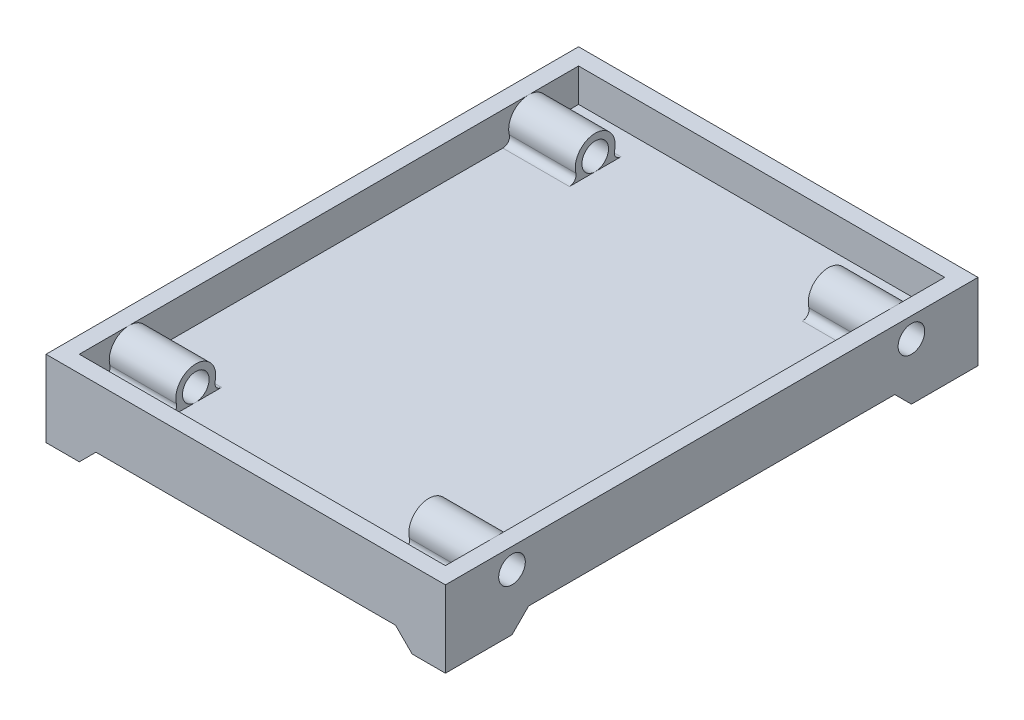
from build123d import *

# Parameters (mm, degrees)
SKETCH1_W           = 76.2
SKETCH1_H           = 101.6
BOSS_EXTRUDE1_DEPTH = 5.08
SKETCH4_W           = 76.2
SKETCH4_H           = 101.6
SKETCH4_W_2         = 69.85
SKETCH4_H_2         = 95.25
BOSS_EXTRUDE3_DEPTH = 6.35
SKETCH5_R           = 3.81
SKETCH5_R_2         = 2.54
BOSS_EXTRUDE4_DEPTH = 73.025
SKETCH6_R           = 2.54
CUT_EXTRUDE2_DEPTH  = 128.513312638
SKETCH7_W           = 44.45
SKETCH7_H           = 95.25
CUT_EXTRUDE3_DEPTH  = 128.158650905
FILLET1_R           = 1.27
SKETCH8_W           = 6.35
SKETCH8_H           = 12.7
BOSS_EXTRUDE5_DEPTH = 3.175
CHAMFER1_SIZE       = 3.175


with BuildPart() as part:
    # Sketch1 → Boss-Extrude1 (new body)
    with BuildSketch(Plane(origin=(0, 0, 0), x_dir=(1, 0, 0), z_dir=(0, 1, 0))):
        with Locations((38.1, 50.8)):
            Rectangle(SKETCH1_W, SKETCH1_H)
    extrude(amount=BOSS_EXTRUDE1_DEPTH)

    # Sketch4 → Boss-Extrude3 (add)
    with BuildSketch(Plane(origin=(0, 5.08, 0), x_dir=(1, 0, 0), z_dir=(0, 1, 0))):
        with Locations((38.1, 50.8)):
            Rectangle(SKETCH4_W, SKETCH4_H)
        with Locations((38.1, 50.8)):
            Rectangle(SKETCH4_W_2, SKETCH4_H_2, mode=Mode.SUBTRACT)
    extrude(amount=BOSS_EXTRUDE3_DEPTH)

    # Sketch5 → Boss-Extrude4 (add)
    # profile 1 of 2: a face of its own
    with BuildSketch(Plane(origin=(76.2, 0, 0), x_dir=(0, 0, -1), z_dir=(1, 0, 0))):
        with Locations((12.7, 7.62)):
            Circle(SKETCH5_R)
        with Locations((12.7, 7.62)):
            Circle(SKETCH5_R_2, mode=Mode.SUBTRACT)
    # profile 2 of 2: a face of its own
    with BuildSketch(Plane(origin=(76.2, 0, 0), x_dir=(0, 0, -1), z_dir=(1, 0, 0))):
        with Locations((88.9, 7.62)):
            Circle(SKETCH5_R)
        with Locations((88.9, 7.62)):
            Circle(SKETCH5_R_2, mode=Mode.SUBTRACT)
    extrude(amount=-BOSS_EXTRUDE4_DEPTH)

    # Sketch6 → Cut-Extrude2 (cut, through all)
    with BuildSketch(Plane(origin=(76.2, 0, 0), x_dir=(0, 0, -1), z_dir=(1, 0, 0))):
        with Locations((12.7, 7.62)):
            Circle(SKETCH6_R)
        with Locations((88.9, 7.62)):
            Circle(SKETCH6_R)
    extrude(amount=-CUT_EXTRUDE2_DEPTH, mode=Mode.SUBTRACT)

    # Sketch7 → Cut-Extrude3 (cut, through all)
    with BuildSketch(Plane(origin=(0, 5.08, 0), x_dir=(1, 0, 0), z_dir=(0, 1, 0))):
        with Locations((38.1, 50.8)):
            Rectangle(SKETCH7_W, SKETCH7_H)
    extrude(amount=CUT_EXTRUDE3_DEPTH, mode=Mode.SUBTRACT)

    # Fillet1
    fillet1_edges = [part.edges().sort_by_distance(p)[0] for p in [
        (66.675, 5.08, -91.739806331),
        (9.525, 5.08, -86.060193669),
        (66.675, 5.08, -15.539806331),
        (9.525, 5.08, -9.860193669),
        (66.675, 5.08, -9.860193669),
        (9.525, 5.08, -15.539806331),
        (66.675, 5.08, -86.060193669),
        (9.525, 5.08, -91.739806331),
    ]]
    fillet(fillet1_edges, radius=FILLET1_R)

    # Sketch8 → Boss-Extrude5 (add)
    with BuildSketch(Plane.XZ):
        with Locations((73.025, -6.35)):
            Rectangle(SKETCH8_W, SKETCH8_H)
        with Locations((73.025, -95.25)):
            Rectangle(SKETCH8_W, SKETCH8_H)
        with Locations((3.175, -95.25)):
            Rectangle(SKETCH8_W, SKETCH8_H)
        with Locations((3.175, -6.35)):
            Rectangle(SKETCH8_W, SKETCH8_H)
    extrude(amount=BOSS_EXTRUDE5_DEPTH)

    # Chamfer1
    chamfer1_edges = [part.edges().sort_by_distance(p)[0] for p in [
        (69.85, 0, -95.25),
        (73.025, 0, -88.9),
        (69.85, 0, -6.35),
        (73.025, 0, -12.7),
        (3.175, 0, -12.7),
        (6.35, 0, -6.35),
        (3.175, 0, -88.9),
        (6.35, 0, -95.25),
    ]]
    chamfer(chamfer1_edges, length=CHAMFER1_SIZE - 0.0001)  # a hair under: the kernel refuses the full size


solid = part.part
